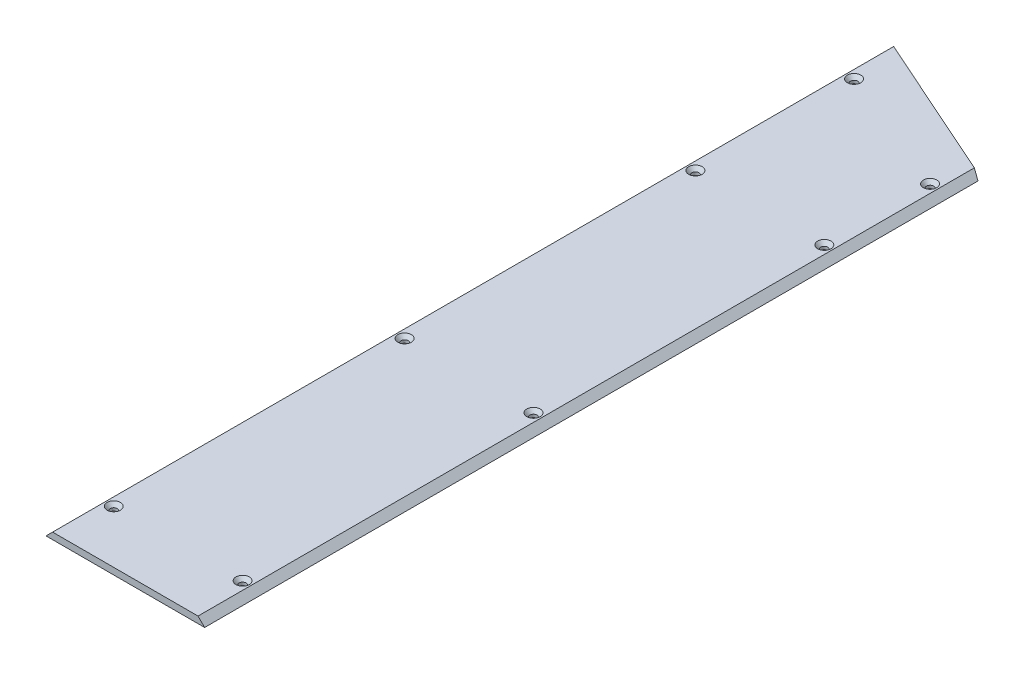
from build123d import *

# Parameters (mm, degrees)
SKETCH1_W                                     = 152.4
SKETCH1_H                                     = 1219.2
BOSS_EXTRUDE1_DEPTH                           = 6.35
CSK_FOR_1_4_FLAT_HEAD_MACHINE_SCREW1_AT_COUNT = 2
CSK_FOR_1_4_FLAT_HEAD_MACHINE_SCREW1_AT_PITCH = 123.825
CSK_FOR_1_4_FLAT_HEAD_MACHINE_SCREW1_2_COUNT  = 2
CSK_FOR_1_4_FLAT_HEAD_MACHINE_SCREW1_2_PITCH  = 305.609212271
CSK_FOR_1_4_FLAT_HEAD_MACHINE_SCREW1_3_COUNT  = 2
CSK_FOR_1_4_FLAT_HEAD_MACHINE_SCREW1_3_PITCH  = 572.354846773
CSK_FOR_1_4_FLAT_HEAD_MACHINE_SCREW1_4_COUNT  = 2
CSK_FOR_1_4_FLAT_HEAD_MACHINE_SCREW1_4_PITCH  = 847.296801968
CSK_FOR_1_4_FLAT_HEAD_MACHINE_SCREW1_5_COUNT  = 2
CSK_FOR_1_4_FLAT_HEAD_MACHINE_SCREW1_5_PITCH  = 1124.438700252
CSK_FOR_1_4_FLAT_HEAD_MACHINE_SCREW1_6_COUNT  = 2
CSK_FOR_1_4_FLAT_HEAD_MACHINE_SCREW1_6_PITCH  = 279.4
CSK_FOR_1_4_FLAT_HEAD_MACHINE_SCREW1_7_COUNT  = 2
CSK_FOR_1_4_FLAT_HEAD_MACHINE_SCREW1_7_PITCH  = 558.8
CSK_FOR_1_4_FLAT_HEAD_MACHINE_SCREW1_8_COUNT  = 2
CSK_FOR_1_4_FLAT_HEAD_MACHINE_SCREW1_8_PITCH  = 838.2
CSK_FOR_1_4_FLAT_HEAD_MACHINE_SCREW1_9_COUNT  = 2
CSK_FOR_1_4_FLAT_HEAD_MACHINE_SCREW1_9_PITCH  = 1117.6
CHAMFER1_SIZE                                 = 6.35
CUT_EXTRUDE1_DEPTH                            = 1229.704489493
CSK_FOR_1_4_FLAT_HEAD_MACHINE_SCREW2_AT_COUNT = 2
CSK_FOR_1_4_FLAT_HEAD_MACHINE_SCREW2_AT_PITCH = 133.840467068


with BuildPart() as part:
    # Sketch1 → Boss-Extrude1 (new body)
    with BuildSketch(Plane(origin=(0, 0, 0), x_dir=(1, 0, 0), z_dir=(0, 1, 0))):
        with Locations((76.2, 609.6)):
            Rectangle(SKETCH1_W, SKETCH1_H)
    extrude(amount=BOSS_EXTRUDE1_DEPTH)

    # Sketch3 → CSK for 1/4 Flat Head Machine Screw1 (revolve, cut)
    with BuildSketch(Plane(origin=(14.2875, 6.35, -1168.4), x_dir=(0, 0, 1), z_dir=(1, 0, 0))):
        Polygon((0, 0), (0, 6.35), (3.3782, 6.35), (3.3782, 3.520932584), (6.4389, 0), align=None)
    csk_for_1_4_flat_head_machine_screw1 = revolve(axis=Axis((14.2875, 12.7, -1168.4), (0, -1, 0)), mode=Mode.SUBTRACT)

    # CSK for 1/4 Flat Head Machine Screw1 at: CSK for 1/4 Flat Head Machine Screw1 ×2
    with Locations(*[(i * CSK_FOR_1_4_FLAT_HEAD_MACHINE_SCREW1_AT_PITCH, 0, 0) for i in range(1, CSK_FOR_1_4_FLAT_HEAD_MACHINE_SCREW1_AT_COUNT)]):
        add(csk_for_1_4_flat_head_machine_screw1, mode=Mode.SUBTRACT)

    # CSK for 1_4 Flat Head Machine Screw1 2: CSK for 1/4 Flat Head Machine Screw1 ×2
    with Locations(*[Vector(0.405174304399354, 0, 0.9142394560805718) * (i * CSK_FOR_1_4_FLAT_HEAD_MACHINE_SCREW1_2_PITCH) for i in range(1, CSK_FOR_1_4_FLAT_HEAD_MACHINE_SCREW1_2_COUNT)]):
        add(csk_for_1_4_flat_head_machine_screw1, mode=Mode.SUBTRACT)

    # CSK for 1_4 Flat Head Machine Screw1 3: CSK for 1/4 Flat Head Machine Screw1 ×2
    with Locations(*[Vector(0.21634306182267615, 0, 0.9763174071997232) * (i * CSK_FOR_1_4_FLAT_HEAD_MACHINE_SCREW1_3_PITCH) for i in range(1, CSK_FOR_1_4_FLAT_HEAD_MACHINE_SCREW1_3_COUNT)]):
        add(csk_for_1_4_flat_head_machine_screw1, mode=Mode.SUBTRACT)

    # CSK for 1_4 Flat Head Machine Screw1 4: CSK for 1/4 Flat Head Machine Screw1 ×2
    with Locations(*[Vector(0.1461412337594335, 0, 0.9892637362176331) * (i * CSK_FOR_1_4_FLAT_HEAD_MACHINE_SCREW1_4_PITCH) for i in range(1, CSK_FOR_1_4_FLAT_HEAD_MACHINE_SCREW1_4_COUNT)]):
        add(csk_for_1_4_flat_head_machine_screw1, mode=Mode.SUBTRACT)

    # CSK for 1_4 Flat Head Machine Screw1 5: CSK for 1/4 Flat Head Machine Screw1 ×2
    with Locations(*[Vector(0.11012160998392527, 0, 0.9939181208804618) * (i * CSK_FOR_1_4_FLAT_HEAD_MACHINE_SCREW1_5_PITCH) for i in range(1, CSK_FOR_1_4_FLAT_HEAD_MACHINE_SCREW1_5_COUNT)]):
        add(csk_for_1_4_flat_head_machine_screw1, mode=Mode.SUBTRACT)

    # CSK for 1_4 Flat Head Machine Screw1 6: CSK for 1/4 Flat Head Machine Screw1 ×2
    with Locations(*[(0, 0, i * CSK_FOR_1_4_FLAT_HEAD_MACHINE_SCREW1_6_PITCH) for i in range(1, CSK_FOR_1_4_FLAT_HEAD_MACHINE_SCREW1_6_COUNT)]):
        add(csk_for_1_4_flat_head_machine_screw1, mode=Mode.SUBTRACT)

    # CSK for 1_4 Flat Head Machine Screw1 7: CSK for 1/4 Flat Head Machine Screw1 ×2
    with Locations(*[(0, 0, i * CSK_FOR_1_4_FLAT_HEAD_MACHINE_SCREW1_7_PITCH) for i in range(1, CSK_FOR_1_4_FLAT_HEAD_MACHINE_SCREW1_7_COUNT)]):
        add(csk_for_1_4_flat_head_machine_screw1, mode=Mode.SUBTRACT)

    # CSK for 1_4 Flat Head Machine Screw1 8: CSK for 1/4 Flat Head Machine Screw1 ×2
    with Locations(*[(0, 0, i * CSK_FOR_1_4_FLAT_HEAD_MACHINE_SCREW1_8_PITCH) for i in range(1, CSK_FOR_1_4_FLAT_HEAD_MACHINE_SCREW1_8_COUNT)]):
        add(csk_for_1_4_flat_head_machine_screw1, mode=Mode.SUBTRACT)

    # CSK for 1_4 Flat Head Machine Screw1 9: CSK for 1/4 Flat Head Machine Screw1 ×2
    with Locations(*[(0, 0, i * CSK_FOR_1_4_FLAT_HEAD_MACHINE_SCREW1_9_PITCH) for i in range(1, CSK_FOR_1_4_FLAT_HEAD_MACHINE_SCREW1_9_COUNT)]):
        add(csk_for_1_4_flat_head_machine_screw1, mode=Mode.SUBTRACT)

    # Chamfer1
    chamfer1_edges = [part.edges().sort_by_distance(p)[0] for p in [
        (0, 6.35, -609.6),
        (152.4, 6.35, -609.6),
    ]]
    chamfer(chamfer1_edges, length=CHAMFER1_SIZE - 0.0001)  # a hair under: the kernel refuses the full size

    # Sketch4 → Cut-Extrude1 (cut, through all)
    with BuildSketch(Plane(origin=(0, 6.35, 0), x_dir=(1, 0, 0), z_dir=(0, 1, 0))):
        Polygon((152.4, 742.95), (0, 810.802851641), (0, 1219.2), (152.4, 1219.2), align=None)
    extrude(amount=-CUT_EXTRUDE1_DEPTH, mode=Mode.SUBTRACT)

    # Sketch6 → CSK for 1/4 Flat Head Machine Screw2 (revolve, cut)
    with BuildSketch(Plane(origin=(14.2875, 6.35, -762), x_dir=(0, 0, 1), z_dir=(1, 0, 0))):
        Polygon((0, 0), (0, 6.35), (3.3782, 6.35), (3.3782, 3.520932584), (6.4389, 0), align=None)
    csk_for_1_4_flat_head_machine_screw2 = revolve(axis=Axis((14.2875, 12.7, -762), (0, -1, 0)), mode=Mode.SUBTRACT)

    # CSK for 1/4 Flat Head Machine Screw2 at: CSK for 1/4 Flat Head Machine Screw2 ×2
    with Locations(*[Vector(0.9251686183747461, 0, 0.3795563562563057) * (i * CSK_FOR_1_4_FLAT_HEAD_MACHINE_SCREW2_AT_PITCH) for i in range(1, CSK_FOR_1_4_FLAT_HEAD_MACHINE_SCREW2_AT_COUNT)]):
        add(csk_for_1_4_flat_head_machine_screw2, mode=Mode.SUBTRACT)


solid = part.part
